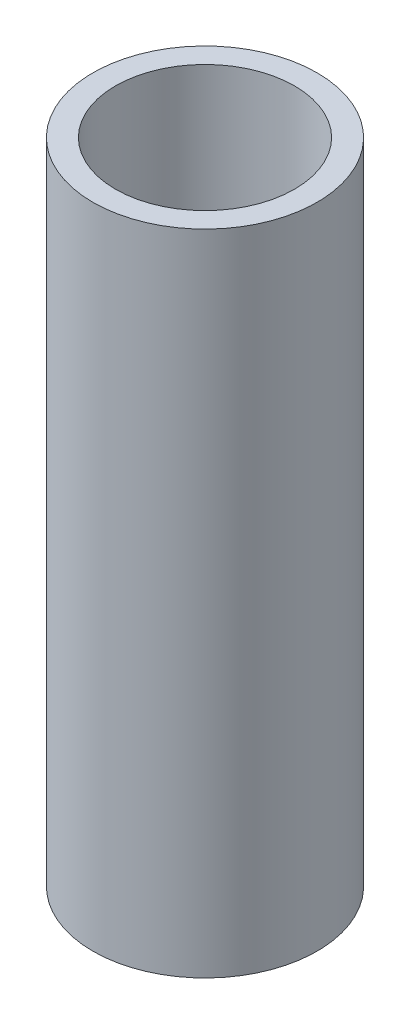
from build123d import *

# Parameters (mm, degrees)
SKETCH1_R           = 37.5
BOSS_EXTRUDE1_DEPTH = 216.870746507
SKETCH2_R           = 29.938011021
CUT_EXTRUDE1_DEPTH  = 224.260880341


with BuildPart() as part:
    # Sketch1 → Boss-Extrude1 (new body)
    with BuildSketch(Plane(origin=(0, 0, 0), x_dir=(1, 0, 0), z_dir=(0, 1, 0))):
        Circle(SKETCH1_R)
    extrude(amount=BOSS_EXTRUDE1_DEPTH)

    # Sketch2 → Cut-Extrude1 (cut, through all)
    with BuildSketch(Plane(origin=(0, 0, 0), x_dir=(1, 0, 0), z_dir=(0, 1, 0))):
        Circle(SKETCH2_R)
    extrude(amount=CUT_EXTRUDE1_DEPTH, mode=Mode.SUBTRACT)


solid = part.part
